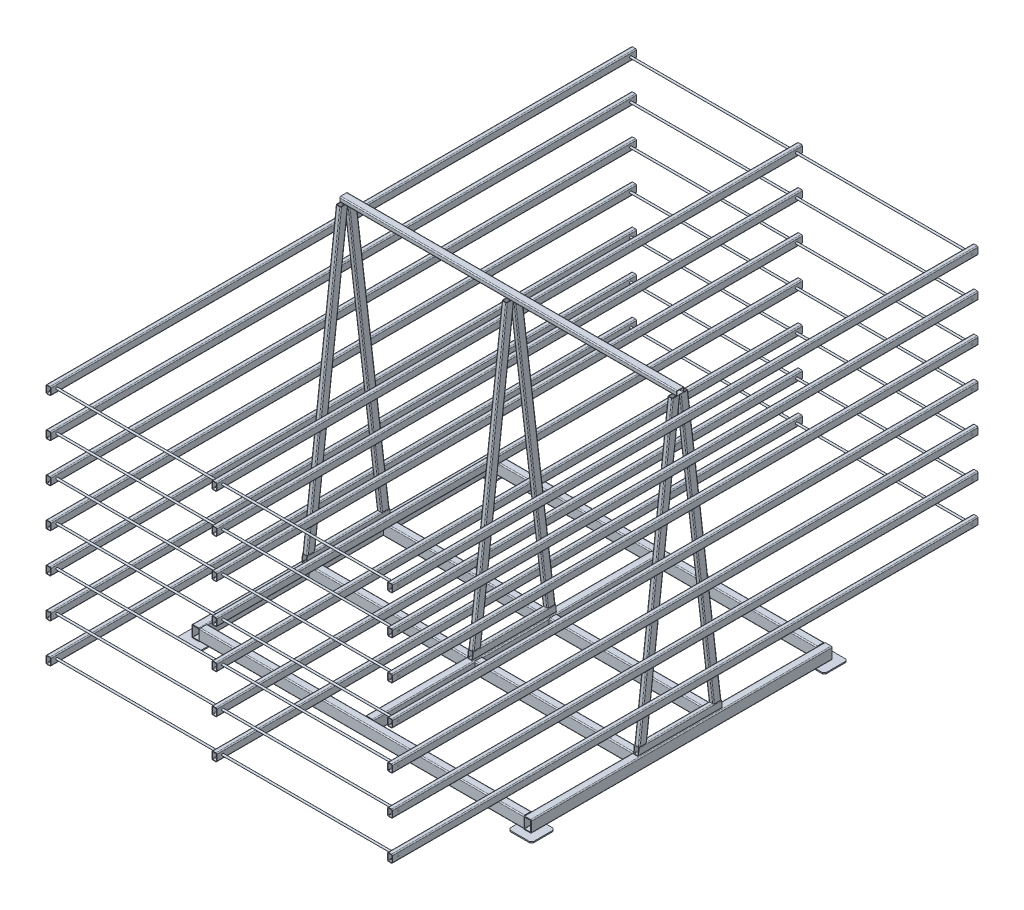
from build123d import *

# Parameters (mm, degrees)
F_50_START                    = -830
F_50_X_30_X_2_6_1_DEPTH       = 1660
F_50_START_2                  = -770
F_50_X_30_X_2_6_1_2_DEPTH     = 1540
F_50_X_30_X_2_6_1_3_DEPTH     = 1540
F_50_X_30_X_2_6_1_4_DEPTH     = 1660
F_50_START_3                  = -730
F_50_X_30_X_2_6_1_5_DEPTH     = 1460
F_50_START_4                  = 20
F_50_X_30_X_2_6_1_6_DEPTH     = 810
F_50_X_30_X_2_6_1_7_DEPTH     = 810
F_50_X_30_X_2_6_1_8_DEPTH     = 810
F_50_X_30_X_2_6_1_9_DEPTH     = 810
SKETCH_9_W                    = 120
SKETCH_9_H                    = 120
EXTRUDE_2_DEPTH               = 6
CHAMFER_1_SIZE                = 10
F_50_START_5                  = 45.123407244
F_50_X_30_X_2_6_4_DEPTH       = 1474.569195559
F_50_START_6                  = 64
F_50_X_30_X_2_6_4_2_OUTLINE_W = 28
F_50_X_30_X_2_6_4_2_OUTLINE_H = 43
F_50_X_30_X_2_6_4_2_DEPTH     = 6
F_50_START_7                  = -175
F_50_X_30_X_2_6_4_3_DEPTH     = 390.271302161
F_50_START_8                  = 217.297470327
F_50_X_30_X_2_6_4_4_OUTLINE_W = 28
F_50_X_30_X_2_6_4_4_OUTLINE_H = 44
F_50_X_30_X_2_6_4_4_DEPTH     = 5.702529673
F_50_X_30_X_2_6_9_DEPTH       = 1725
F_50_X_30_X_2_6_10_DEPTH      = 3000
PATTERN_LINEAR_2_COUNT        = 7
PATTERN_LINEAR_2_PITCH        = 200
PATTERN_LINEAR_3_COUNT        = 2
PATTERN_LINEAR_3_PITCH        = 850
SKETCH_8_R                    = 5
CUT_EXTRUDE_1_DEPTH           = 2345.381581569
PATTERN_LINEAR_4_COUNT        = 7
PATTERN_LINEAR_4_PITCH        = 200
EXTRUDE_1_DEPTH               = 887.5
EXTRUDE_1_DEPTH_BACK          = 887.5
SKETCH_8_2_R                  = 5
PATTERN_LINEAR_5_COUNT        = 7
PATTERN_LINEAR_5_PITCH        = 200
MIRROR_4_COPY_1_SKETCH_R      = 5
MIRROR_4_COPY_1_DEPTH         = 2345.381581569
MIRROR_4_COPY_2_SKETCH_R      = 5
MIRROR_4_COPY_2_DEPTH         = 2345.381581569
MIRROR_4_COPY_3_SKETCH_R      = 5
MIRROR_4_COPY_3_DEPTH         = 2345.381581569
MIRROR_4_COPY_4_SKETCH_R      = 5
MIRROR_4_COPY_4_DEPTH         = 2345.381581569
MIRROR_4_COPY_5_SKETCH_R      = 5
MIRROR_4_COPY_5_DEPTH         = 2345.381581569
MIRROR_4_COPY_6_SKETCH_R      = 5
MIRROR_4_COPY_6_DEPTH         = 2345.381581569
MIRROR_5_ANGLE                = 180
MIRROR_5_2_ANGLE              = 180
MIRROR_5_3_ANGLE              = 180
MIRROR_5_4_ANGLE              = 180
MIRROR_5_5_ANGLE              = 180
MIRROR_5_6_ANGLE              = 180
MIRROR_5_7_ANGLE              = 180


with BuildPart() as part:
    # Прямоугольная труба 50 X 30 X 2.6(1): read off the stored shape, not the designer's step
    # Прямоугольная труба 50 X 30 X 2.6(1) outline → Прямоугольная труба 50 X 30 X 2.6(1) (new body)
    with BuildSketch(Plane.YZ.offset(F_50_START)):
        with BuildLine():
            ThreePointArc((24.8, -770), (28.476955262, -768.476955262), (30, -764.8))
            Line((30, -764.8), (30, -735.2))
            ThreePointArc((30, -735.2), (28.476955262, -731.523044738), (24.8, -730))
            Line((24.8, -730), (-24.8, -730))
            ThreePointArc((-24.8, -730), (-28.476955262, -731.523044738), (-30, -735.2))
            Line((-30, -735.2), (-30, -764.8))
            ThreePointArc((-30, -764.8), (-28.476955262, -768.476955262), (-24.8, -770))
            Line((-24.8, -770), (24.8, -770))
        make_face()
        with BuildLine():
            Line((-24.8, -734), (24.8, -734))
            ThreePointArc((24.8, -734), (25.648528137, -734.351471863), (26, -735.2))
            Line((26, -735.2), (26, -764.8))
            ThreePointArc((26, -764.8), (25.648528137, -765.648528137), (24.8, -766))
            Line((24.8, -766), (-24.8, -766))
            ThreePointArc((-24.8, -766), (-25.648528137, -765.648528137), (-26, -764.8))
            Line((-26, -764.8), (-26, -735.2))
            ThreePointArc((-26, -735.2), (-25.648528137, -734.351471863), (-24.8, -734))
        make_face(mode=Mode.SUBTRACT)
    extrude(amount=F_50_X_30_X_2_6_1_DEPTH)


with BuildPart() as body_2:
    # 50 X 30 X 2.6_1 2 outline → 50 X 30 X 2.6_1 2 (new body)
    with BuildSketch(Plane.XY.offset(F_50_START_2)):
        with BuildLine():
            Line((-835.2, 30), (-864.8, 30))
            ThreePointArc((-864.8, 30), (-868.476955262, 28.476955262), (-870, 24.8))
            Line((-870, 24.8), (-870, -24.8))
            ThreePointArc((-870, -24.8), (-868.476955262, -28.476955262), (-864.8, -30))
            Line((-864.8, -30), (-835.2, -30))
            ThreePointArc((-835.2, -30), (-831.523044738, -28.476955262), (-830, -24.8))
            Line((-830, -24.8), (-830, 24.8))
            ThreePointArc((-830, 24.8), (-831.523044738, 28.476955262), (-835.2, 30))
        make_face()
        with BuildLine():
            ThreePointArc((-835.2, 26), (-834.351471863, 25.648528137), (-834, 24.8))
            Line((-834, 24.8), (-834, -24.8))
            ThreePointArc((-834, -24.8), (-834.351471863, -25.648528137), (-835.2, -26))
            Line((-835.2, -26), (-864.8, -26))
            ThreePointArc((-864.8, -26), (-865.648528137, -25.648528137), (-866, -24.8))
            Line((-866, -24.8), (-866, 24.8))
            ThreePointArc((-866, 24.8), (-865.648528137, 25.648528137), (-864.8, 26))
            Line((-864.8, 26), (-835.2, 26))
        make_face(mode=Mode.SUBTRACT)
    extrude(amount=F_50_X_30_X_2_6_1_2_DEPTH)


with BuildPart() as body_3:
    # 50 X 30 X 2.6_1 3 outline → 50 X 30 X 2.6_1 3 (new body)
    with BuildSketch(Plane.XY.offset(F_50_START_2)):
        with BuildLine():
            ThreePointArc((870, 24.8), (868.476955262, 28.476955262), (864.8, 30))
            Line((864.8, 30), (835.2, 30))
            ThreePointArc((835.2, 30), (831.523044738, 28.476955262), (830, 24.8))
            Line((830, 24.8), (830, -24.8))
            ThreePointArc((830, -24.8), (831.523044738, -28.476955262), (835.2, -30))
            Line((835.2, -30), (864.8, -30))
            ThreePointArc((864.8, -30), (868.476955262, -28.476955262), (870, -24.8))
            Line((870, -24.8), (870, 24.8))
        make_face()
        with BuildLine():
            Line((834, -24.8), (834, 24.8))
            ThreePointArc((834, 24.8), (834.351471863, 25.648528137), (835.2, 26))
            Line((835.2, 26), (864.8, 26))
            ThreePointArc((864.8, 26), (865.648528137, 25.648528137), (866, 24.8))
            Line((866, 24.8), (866, -24.8))
            ThreePointArc((866, -24.8), (865.648528137, -25.648528137), (864.8, -26))
            Line((864.8, -26), (835.2, -26))
            ThreePointArc((835.2, -26), (834.351471863, -25.648528137), (834, -24.8))
        make_face(mode=Mode.SUBTRACT)
    extrude(amount=F_50_X_30_X_2_6_1_3_DEPTH)


with BuildPart() as body_4:
    # 50 X 30 X 2.6_1 4 outline → 50 X 30 X 2.6_1 4 (new body)
    with BuildSketch(Plane.YZ.offset(F_50_START)):
        with BuildLine():
            Line((30, 735.2), (30, 764.8))
            ThreePointArc((30, 764.8), (28.476955262, 768.476955262), (24.8, 770))
            Line((24.8, 770), (-24.8, 770))
            ThreePointArc((-24.8, 770), (-28.476955262, 768.476955262), (-30, 764.8))
            Line((-30, 764.8), (-30, 735.2))
            ThreePointArc((-30, 735.2), (-28.476955262, 731.523044738), (-24.8, 730))
            Line((-24.8, 730), (24.8, 730))
            ThreePointArc((24.8, 730), (28.476955262, 731.523044738), (30, 735.2))
        make_face()
        with BuildLine():
            ThreePointArc((26, 735.2), (25.648528137, 734.351471863), (24.8, 734))
            Line((24.8, 734), (-24.8, 734))
            ThreePointArc((-24.8, 734), (-25.648528137, 734.351471863), (-26, 735.2))
            Line((-26, 735.2), (-26, 764.8))
            ThreePointArc((-26, 764.8), (-25.648528137, 765.648528137), (-24.8, 766))
            Line((-24.8, 766), (24.8, 766))
            ThreePointArc((24.8, 766), (25.648528137, 765.648528137), (26, 764.8))
            Line((26, 764.8), (26, 735.2))
        make_face(mode=Mode.SUBTRACT)
    extrude(amount=F_50_X_30_X_2_6_1_4_DEPTH)


with BuildPart() as body_5:
    # 50 X 30 X 2.6_1 5 outline → 50 X 30 X 2.6_1 5 (new body)
    with BuildSketch(Plane.XY.offset(F_50_START_3)):
        with BuildLine():
            ThreePointArc((20, 24.8), (18.476955262, 28.476955262), (14.8, 30))
            Line((14.8, 30), (-14.8, 30))
            ThreePointArc((-14.8, 30), (-18.476955262, 28.476955262), (-20, 24.8))
            Line((-20, 24.8), (-20, -24.8))
            ThreePointArc((-20, -24.8), (-18.476955262, -28.476955262), (-14.8, -30))
            Line((-14.8, -30), (14.8, -30))
            ThreePointArc((14.8, -30), (18.476955262, -28.476955262), (20, -24.8))
            Line((20, -24.8), (20, 24.8))
        make_face()
        with BuildLine():
            Line((-16, -24.8), (-16, 24.8))
            ThreePointArc((-16, 24.8), (-15.648528137, 25.648528137), (-14.8, 26))
            Line((-14.8, 26), (14.8, 26))
            ThreePointArc((14.8, 26), (15.648528137, 25.648528137), (16, 24.8))
            Line((16, 24.8), (16, -24.8))
            ThreePointArc((16, -24.8), (15.648528137, -25.648528137), (14.8, -26))
            Line((14.8, -26), (-14.8, -26))
            ThreePointArc((-14.8, -26), (-15.648528137, -25.648528137), (-16, -24.8))
        make_face(mode=Mode.SUBTRACT)
    extrude(amount=F_50_X_30_X_2_6_1_5_DEPTH)


with BuildPart() as body_6:
    # 50 X 30 X 2.6_1 6 outline → 50 X 30 X 2.6_1 6 (new body)
    with BuildSketch(Plane.YZ.offset(F_50_START_4)):
        with BuildLine():
            Line((30, -205.3), (30, -175.7))
            ThreePointArc((30, -175.7), (28.476955262, -172.023044738), (24.8, -170.5))
            Line((24.8, -170.5), (-24.8, -170.5))
            ThreePointArc((-24.8, -170.5), (-28.476955262, -172.023044738), (-30, -175.7))
            Line((-30, -175.7), (-30, -205.3))
            ThreePointArc((-30, -205.3), (-28.476955262, -208.976955262), (-24.8, -210.5))
            Line((-24.8, -210.5), (24.8, -210.5))
            ThreePointArc((24.8, -210.5), (28.476955262, -208.976955262), (30, -205.3))
        make_face()
        with BuildLine():
            ThreePointArc((26, -205.3), (25.648528137, -206.148528137), (24.8, -206.5))
            Line((24.8, -206.5), (-24.8, -206.5))
            ThreePointArc((-24.8, -206.5), (-25.648528137, -206.148528137), (-26, -205.3))
            Line((-26, -205.3), (-26, -175.7))
            ThreePointArc((-26, -175.7), (-25.648528137, -174.851471863), (-24.8, -174.5))
            Line((-24.8, -174.5), (24.8, -174.5))
            ThreePointArc((24.8, -174.5), (25.648528137, -174.851471863), (26, -175.7))
            Line((26, -175.7), (26, -205.3))
        make_face(mode=Mode.SUBTRACT)
    extrude(amount=F_50_X_30_X_2_6_1_6_DEPTH)


with BuildPart() as body_7:
    # 50 X 30 X 2.6_1 7 outline → 50 X 30 X 2.6_1 7 (new body)
    with BuildSketch(Plane.YZ.offset(F_50_START)):
        with BuildLine():
            Line((24.8, -170.5), (-24.8, -170.5))
            ThreePointArc((-24.8, -170.5), (-28.476955262, -172.023044738), (-30, -175.7))
            Line((-30, -175.7), (-30, -205.3))
            ThreePointArc((-30, -205.3), (-28.476955262, -208.976955262), (-24.8, -210.5))
            Line((-24.8, -210.5), (24.8, -210.5))
            ThreePointArc((24.8, -210.5), (28.476955262, -208.976955262), (30, -205.3))
            Line((30, -205.3), (30, -175.7))
            ThreePointArc((30, -175.7), (28.476955262, -172.023044738), (24.8, -170.5))
        make_face()
        with BuildLine():
            ThreePointArc((26, -205.3), (25.648528137, -206.148528137), (24.8, -206.5))
            Line((24.8, -206.5), (-24.8, -206.5))
            ThreePointArc((-24.8, -206.5), (-25.648528137, -206.148528137), (-26, -205.3))
            Line((-26, -205.3), (-26, -175.7))
            ThreePointArc((-26, -175.7), (-25.648528137, -174.851471863), (-24.8, -174.5))
            Line((-24.8, -174.5), (24.8, -174.5))
            ThreePointArc((24.8, -174.5), (25.648528137, -174.851471863), (26, -175.7))
            Line((26, -175.7), (26, -205.3))
        make_face(mode=Mode.SUBTRACT)
    extrude(amount=F_50_X_30_X_2_6_1_7_DEPTH)


with BuildPart() as body_8:
    # 50 X 30 X 2.6_1 8 outline → 50 X 30 X 2.6_1 8 (new body)
    with BuildSketch(Plane.YZ.offset(F_50_START_4)):
        with BuildLine():
            Line((30, 175.7), (30, 205.3))
            ThreePointArc((30, 205.3), (28.476955262, 208.976955262), (24.8, 210.5))
            Line((24.8, 210.5), (-24.8, 210.5))
            ThreePointArc((-24.8, 210.5), (-28.476955262, 208.976955262), (-30, 205.3))
            Line((-30, 205.3), (-30, 175.7))
            ThreePointArc((-30, 175.7), (-28.476955262, 172.023044738), (-24.8, 170.5))
            Line((-24.8, 170.5), (24.8, 170.5))
            ThreePointArc((24.8, 170.5), (28.476955262, 172.023044738), (30, 175.7))
        make_face()
        with BuildLine():
            ThreePointArc((26, 175.7), (25.648528137, 174.851471863), (24.8, 174.5))
            Line((24.8, 174.5), (-24.8, 174.5))
            ThreePointArc((-24.8, 174.5), (-25.648528137, 174.851471863), (-26, 175.7))
            Line((-26, 175.7), (-26, 205.3))
            ThreePointArc((-26, 205.3), (-25.648528137, 206.148528137), (-24.8, 206.5))
            Line((-24.8, 206.5), (24.8, 206.5))
            ThreePointArc((24.8, 206.5), (25.648528137, 206.148528137), (26, 205.3))
            Line((26, 205.3), (26, 175.7))
        make_face(mode=Mode.SUBTRACT)
    extrude(amount=F_50_X_30_X_2_6_1_8_DEPTH)


with BuildPart() as body_9:
    # 50 X 30 X 2.6_1 9 outline → 50 X 30 X 2.6_1 9 (new body)
    with BuildSketch(Plane.YZ.offset(F_50_START)):
        with BuildLine():
            Line((24.8, 210.5), (-24.8, 210.5))
            ThreePointArc((-24.8, 210.5), (-28.476955262, 208.976955262), (-30, 205.3))
            Line((-30, 205.3), (-30, 175.7))
            ThreePointArc((-30, 175.7), (-28.476955262, 172.023044738), (-24.8, 170.5))
            Line((-24.8, 170.5), (24.8, 170.5))
            ThreePointArc((24.8, 170.5), (28.476955262, 172.023044738), (30, 175.7))
            Line((30, 175.7), (30, 205.3))
            ThreePointArc((30, 205.3), (28.476955262, 208.976955262), (24.8, 210.5))
        make_face()
        with BuildLine():
            ThreePointArc((26, 175.7), (25.648528137, 174.851471863), (24.8, 174.5))
            Line((24.8, 174.5), (-24.8, 174.5))
            ThreePointArc((-24.8, 174.5), (-25.648528137, 174.851471863), (-26, 175.7))
            Line((-26, 175.7), (-26, 205.3))
            ThreePointArc((-26, 205.3), (-25.648528137, 206.148528137), (-24.8, 206.5))
            Line((-24.8, 206.5), (24.8, 206.5))
            ThreePointArc((24.8, 206.5), (25.648528137, 206.148528137), (26, 205.3))
            Line((26, 205.3), (26, 175.7))
        make_face(mode=Mode.SUBTRACT)
    extrude(amount=F_50_X_30_X_2_6_1_9_DEPTH)


with BuildPart() as body_10:
    # Эскиз9 → Бобышка-Вытянуть2 (new body)
    with BuildSketch(Plane.XZ.offset(30)):
        with Locations((850, 750)):
            Rectangle(SKETCH_9_W, SKETCH_9_H)
    extrude(amount=EXTRUDE_2_DEPTH)

    # Фаска1
    chamfer_1_edges = [body_10.edges().sort_by_distance(p)[0] for p in [
        (910, -33, 690),
        (790, -33, 690),
        (790, -33, 810),
        (910, -33, 810),
    ]]
    chamfer(chamfer_1_edges, length=CHAMFER_1_SIZE)


with BuildPart() as body_11:
    # Зеркальное отражение6: mirrored copy
    add(body_10.part.mirror(Plane(origin=(0, 0, 0), x_dir=(0, 0, 1), z_dir=(1, 0, 0))))


with BuildPart() as body_12:
    # Зеркальное отражение7: mirrored copy
    add(body_10.part.mirror(Plane.XY))


with BuildPart() as body_13:
    # Mirror 7 2: mirrored copy
    add(body_11.part.mirror(Plane.XY))


with BuildPart() as body_14:
    # Прямоугольная труба 50 X 30 X 2.6(4): read off the stored shape, not the designer's step
    # Прямоугольная труба 50 X 30 X 2.6(4) outline → Прямоугольная труба 50 X 30 X 2.6(4) (new body)
    with BuildSketch(Plane(origin=(0, 0, 0), x_dir=(1, 0, 0), z_dir=(0, 0.9932631390872431, -0.11588069956017802)).offset(F_50_START_5)):
        with BuildLine():
            Line((-837.5, -212.097470327), (-837.5, -182.497470327))
            ThreePointArc((-837.5, -182.497470327), (-839.023044738, -178.820515065), (-842.7, -177.297470327))
            Line((-842.7, -177.297470327), (-857.3, -177.297470327))
            ThreePointArc((-857.3, -177.297470327), (-860.976955262, -178.820515065), (-862.5, -182.497470327))
            Line((-862.5, -182.497470327), (-862.5, -212.097470327))
            ThreePointArc((-862.5, -212.097470327), (-860.976955262, -215.774425589), (-857.3, -217.297470327))
            Line((-857.3, -217.297470327), (-842.7, -217.297470327))
            ThreePointArc((-842.7, -217.297470327), (-839.023044738, -215.774425589), (-837.5, -212.097470327))
        make_face()
        with BuildLine():
            ThreePointArc((-857.3, -214.697470327), (-859.138477631, -213.935947958), (-859.9, -212.097470327))
            Line((-859.9, -212.097470327), (-859.9, -182.497470327))
            ThreePointArc((-859.9, -182.497470327), (-859.138477631, -180.658992696), (-857.3, -179.897470327))
            Line((-857.3, -179.897470327), (-842.7, -179.897470327))
            ThreePointArc((-842.7, -179.897470327), (-840.861522369, -180.658992696), (-840.1, -182.497470327))
            Line((-840.1, -182.497470327), (-840.1, -212.097470327))
            ThreePointArc((-840.1, -212.097470327), (-840.861522369, -213.935947958), (-842.7, -214.697470327))
            Line((-842.7, -214.697470327), (-857.3, -214.697470327))
        make_face(mode=Mode.SUBTRACT)
    extrude(amount=F_50_X_30_X_2_6_4_DEPTH)

    # 50 X 30 X 2.6_4 2 outline → 50 X 30 X 2.6_4 2 (cut)
    with BuildSketch(Plane(origin=(0, 0, 0), x_dir=(1, 0, 0), z_dir=(0, 1, 0)).offset(F_50_START_6)):
        with Locations((-850, -190.5)):
            Rectangle(F_50_X_30_X_2_6_4_2_OUTLINE_W, F_50_X_30_X_2_6_4_2_OUTLINE_H)
    extrude(amount=F_50_X_30_X_2_6_4_2_DEPTH, mode=Mode.SUBTRACT)


with BuildPart() as body_15:
    # 50 X 30 X 2.6_4 3 outline → 50 X 30 X 2.6_4 3 (new body)
    with BuildSketch(Plane.XY.offset(F_50_START_7)):
        with BuildLine():
            ThreePointArc((-837.5, 64.8), (-839.023044738, 68.476955262), (-842.7, 70))
            Line((-842.7, 70), (-857.3, 70))
            ThreePointArc((-857.3, 70), (-860.976955262, 68.476955262), (-862.5, 64.8))
            Line((-862.5, 64.8), (-862.5, 35.2))
            ThreePointArc((-862.5, 35.2), (-860.976955262, 31.523044738), (-857.3, 30))
            Line((-857.3, 30), (-842.7, 30))
            ThreePointArc((-842.7, 30), (-839.023044738, 31.523044738), (-837.5, 35.2))
            Line((-837.5, 35.2), (-837.5, 64.8))
        make_face()
        with BuildLine():
            Line((-859.9, 35.2), (-859.9, 64.8))
            ThreePointArc((-859.9, 64.8), (-859.138477631, 66.638477631), (-857.3, 67.4))
            Line((-857.3, 67.4), (-842.7, 67.4))
            ThreePointArc((-842.7, 67.4), (-840.861522369, 66.638477631), (-840.1, 64.8))
            Line((-840.1, 64.8), (-840.1, 35.2))
            ThreePointArc((-840.1, 35.2), (-840.861522369, 33.361522369), (-842.7, 32.6))
            Line((-842.7, 32.6), (-857.3, 32.6))
            ThreePointArc((-857.3, 32.6), (-859.138477631, 33.361522369), (-859.9, 35.2))
        make_face(mode=Mode.SUBTRACT)
    extrude(amount=F_50_X_30_X_2_6_4_3_DEPTH)

    # 50 X 30 X 2.6_4 4 outline → 50 X 30 X 2.6_4 4 (cut)
    with BuildSketch(Plane(origin=(0, 0, 0), x_dir=(1, 0, 0), z_dir=(0, 0.11588069956017802, 0.9932631390872431)).offset(F_50_START_8)):
        with Locations((-850, 25)):
            Rectangle(F_50_X_30_X_2_6_4_4_OUTLINE_W, F_50_X_30_X_2_6_4_4_OUTLINE_H)
    extrude(amount=F_50_X_30_X_2_6_4_4_DEPTH, mode=Mode.SUBTRACT)


with BuildPart() as body_16:
    # Weld Trim 1: read off the stored shape, not the designer's step
    # Weld Trim 1: the piece on the far side of the plane
    add(body_15.part)
    split(bisect_by=Plane.XY, keep=Keep.BOTTOM)


with BuildPart() as body_15_1:
    add(body_15.part)

    # Weld Trim 1
    split(bisect_by=Plane.XY, keep=Keep.TOP)


with BuildPart() as body_16_2:
    # Зеркальное отражение2: mirrored copy
    add(body_14.part.mirror(Plane.XY))

    # Weld Trim 2 2
    split(bisect_by=Plane.XZ.offset(-1530), keep=Keep.TOP)


with BuildPart() as body_17:
    # Mirror 2 2: mirrored copy
    add(body_15_1.part.mirror(Plane.XY))

    # Combine 1: union body 15
    add(body_15_1.part)


with BuildPart() as body_14_1:
    add(body_14.part)

    # Weld Trim 2 2
    split(bisect_by=Plane.XZ.offset(-1530), keep=Keep.TOP)


with BuildPart() as body_17_2:
    # Линейный массив1: read off the stored shape, not the designer's step
    # Линейный массив1: copy of body 17
    add(body_17.part.moved(Location((1700, 0, 0))))


with BuildPart() as body_18:
    # Pattern Linear 1 2: copy of body 17
    add(body_17.part.moved(Location((850, 0, 0))))


with BuildPart() as body_19:
    # Pattern Linear 1 3: copy of body 16 2
    add(body_16_2.part.moved(Location((1700, 0, 0))))


with BuildPart() as body_20:
    # Pattern Linear 1 4: copy of body 16 2
    add(body_16_2.part.moved(Location((850, 0, 0))))


with BuildPart() as body_21:
    # Pattern Linear 1 5: copy of body 14
    add(body_14_1.part.moved(Location((1700, 0, 0))))


with BuildPart() as body_22:
    # Pattern Linear 1 6: copy of body 14
    add(body_14_1.part.moved(Location((850, 0, 0))))


with BuildPart() as body_23:
    # Sketch12 → Прямоугольная труба 50 X 30 X 2.6(9) (new body)
    with BuildSketch(Plane(origin=(-862.5, 1542.5, 0), x_dir=(0, 1, 0), z_dir=(1, 0, 0))):
        with BuildLine():
            Line((-7.3, -20), (7.3, -20))
            ThreePointArc((7.3, -20), (10.976955262, -18.476955262), (12.5, -14.8))
            Line((12.5, -14.8), (12.5, 14.8))
            ThreePointArc((12.5, 14.8), (10.976955262, 18.476955262), (7.3, 20))
            Line((7.3, 20), (-7.3, 20))
            ThreePointArc((-7.3, 20), (-10.976955262, 18.476955262), (-12.5, 14.8))
            Line((-12.5, 14.8), (-12.5, -14.8))
            ThreePointArc((-12.5, -14.8), (-10.976955262, -18.476955262), (-7.3, -20))
        make_face()
        with BuildLine():
            Line((-7.3, -17.4), (7.3, -17.4))
            ThreePointArc((7.3, -17.4), (9.138477631, -16.638477631), (9.9, -14.8))
            Line((9.9, -14.8), (9.9, 14.8))
            ThreePointArc((9.9, 14.8), (9.138477631, 16.638477631), (7.3, 17.4))
            Line((7.3, 17.4), (-7.3, 17.4))
            ThreePointArc((-7.3, 17.4), (-9.138477631, 16.638477631), (-9.9, 14.8))
            Line((-9.9, 14.8), (-9.9, -14.8))
            ThreePointArc((-9.9, -14.8), (-9.138477631, -16.638477631), (-7.3, -17.4))
        make_face(mode=Mode.SUBTRACT)
    extrude(amount=F_50_X_30_X_2_6_9_DEPTH)


with BuildPart() as body_24:
    # Sketch13 → Прямоугольная труба 50 X 30 X 2.6(10) (new body)
    with BuildSketch(Plane(origin=(-875, 230, -1500), x_dir=(1, 0, 0), z_dir=(0, 0, 1))):
        with BuildLine():
            Line((-7.3, -20), (7.3, -20))
            ThreePointArc((7.3, -20), (10.976955262, -18.476955262), (12.5, -14.8))
            Line((12.5, -14.8), (12.5, 14.8))
            ThreePointArc((12.5, 14.8), (10.976955262, 18.476955262), (7.3, 20))
            Line((7.3, 20), (-7.3, 20))
            ThreePointArc((-7.3, 20), (-10.976955262, 18.476955262), (-12.5, 14.8))
            Line((-12.5, 14.8), (-12.5, -14.8))
            ThreePointArc((-12.5, -14.8), (-10.976955262, -18.476955262), (-7.3, -20))
        make_face()
        with BuildLine():
            Line((-7.3, -17.4), (7.3, -17.4))
            ThreePointArc((7.3, -17.4), (9.138477631, -16.638477631), (9.9, -14.8))
            Line((9.9, -14.8), (9.9, 14.8))
            ThreePointArc((9.9, 14.8), (9.138477631, 16.638477631), (7.3, 17.4))
            Line((7.3, 17.4), (-7.3, 17.4))
            ThreePointArc((-7.3, 17.4), (-9.138477631, 16.638477631), (-9.9, 14.8))
            Line((-9.9, 14.8), (-9.9, -14.8))
            ThreePointArc((-9.9, -14.8), (-9.138477631, -16.638477631), (-7.3, -17.4))
        make_face(mode=Mode.SUBTRACT)
    extrude(amount=F_50_X_30_X_2_6_10_DEPTH)


with BuildPart() as pattern_linear_2_1:
    # Линейный массив2: pattern copy
    add(body_24.part.moved(Location(Vector(0, 1, 0) * (1 * PATTERN_LINEAR_2_PITCH))))


with BuildPart() as pattern_linear_2_2:
    # Линейный массив2: pattern copy
    add(body_24.part.moved(Location(Vector(0, 1, 0) * (2 * PATTERN_LINEAR_2_PITCH))))


with BuildPart() as pattern_linear_2_3:
    # Линейный массив2: pattern copy
    add(body_24.part.moved(Location(Vector(0, 1, 0) * (3 * PATTERN_LINEAR_2_PITCH))))


with BuildPart() as pattern_linear_2_4:
    # Линейный массив2: pattern copy
    add(body_24.part.moved(Location(Vector(0, 1, 0) * (4 * PATTERN_LINEAR_2_PITCH))))


with BuildPart() as pattern_linear_2_5:
    # Линейный массив2: pattern copy
    add(body_24.part.moved(Location(Vector(0, 1, 0) * (5 * PATTERN_LINEAR_2_PITCH))))


with BuildPart() as pattern_linear_2_6:
    # Линейный массив2: pattern copy
    add(body_24.part.moved(Location(Vector(0, 1, 0) * (6 * PATTERN_LINEAR_2_PITCH))))


with BuildPart() as body_31:
    # Зеркальное отражение3: mirrored copy
    add(body_24.part.mirror(Plane(origin=(0, 0, 0), x_dir=(0, 0, 1), z_dir=(1, 0, 0))))


with BuildPart() as body_32:
    # Mirror 3 2: mirrored copy
    add(pattern_linear_2_1.part.mirror(Plane(origin=(0, 0, 0), x_dir=(0, 0, 1), z_dir=(1, 0, 0))))


with BuildPart() as body_33:
    # Mirror 3 3: mirrored copy
    add(pattern_linear_2_2.part.mirror(Plane(origin=(0, 0, 0), x_dir=(0, 0, 1), z_dir=(1, 0, 0))))


with BuildPart() as body_34:
    # Mirror 3 4: mirrored copy
    add(pattern_linear_2_3.part.mirror(Plane(origin=(0, 0, 0), x_dir=(0, 0, 1), z_dir=(1, 0, 0))))


with BuildPart() as body_35:
    # Mirror 3 5: mirrored copy
    add(pattern_linear_2_4.part.mirror(Plane(origin=(0, 0, 0), x_dir=(0, 0, 1), z_dir=(1, 0, 0))))


with BuildPart() as body_36:
    # Mirror 3 6: mirrored copy
    add(pattern_linear_2_5.part.mirror(Plane(origin=(0, 0, 0), x_dir=(0, 0, 1), z_dir=(1, 0, 0))))


with BuildPart() as body_37:
    # Mirror 3 7: mirrored copy
    add(pattern_linear_2_6.part.mirror(Plane(origin=(0, 0, 0), x_dir=(0, 0, 1), z_dir=(1, 0, 0))))


with BuildPart() as pattern_linear_3_1:
    # Линейный массив3: pattern copy
    add(body_24.part.moved(Location(Vector(1, 0, 0) * (1 * PATTERN_LINEAR_3_PITCH))))


with BuildPart() as pattern_linear_3_2:
    # Линейный массив3: pattern copy
    add(pattern_linear_2_1.part.moved(Location(Vector(1, 0, 0) * (1 * PATTERN_LINEAR_3_PITCH))))


with BuildPart() as pattern_linear_3_3:
    # Линейный массив3: pattern copy
    add(pattern_linear_2_2.part.moved(Location(Vector(1, 0, 0) * (1 * PATTERN_LINEAR_3_PITCH))))


with BuildPart() as pattern_linear_3_4:
    # Линейный массив3: pattern copy
    add(pattern_linear_2_3.part.moved(Location(Vector(1, 0, 0) * (1 * PATTERN_LINEAR_3_PITCH))))


with BuildPart() as pattern_linear_3_5:
    # Линейный массив3: pattern copy
    add(pattern_linear_2_4.part.moved(Location(Vector(1, 0, 0) * (1 * PATTERN_LINEAR_3_PITCH))))


with BuildPart() as pattern_linear_3_6:
    # Линейный массив3: pattern copy
    add(pattern_linear_2_5.part.moved(Location(Vector(1, 0, 0) * (1 * PATTERN_LINEAR_3_PITCH))))


with BuildPart() as pattern_linear_3_7:
    # Линейный массив3: pattern copy
    add(pattern_linear_2_6.part.moved(Location(Vector(1, 0, 0) * (1 * PATTERN_LINEAR_3_PITCH))))


with BuildPart() as cut_extrude_1_tool:
    # Эскиз8 → Вырез-Вытянуть1 (new, symmetric)
    with BuildSketch(Plane(origin=(0, 0, 0), x_dir=(0, 0, -1), z_dir=(1, 0, 0))):
        with Locations((-1470, 1430)):
            Circle(SKETCH_8_R)
    cut_extrude_1 = extrude(amount=CUT_EXTRUDE_1_DEPTH, both=True)


with BuildPart() as pattern_linear_2_6_1:
    add(pattern_linear_2_6.part)

    # Вырез-Вытянуть1: cut by cut_extrude_1_tool
    add(cut_extrude_1_tool.part, mode=Mode.SUBTRACT)


with BuildPart() as body_37_1:
    add(body_37.part)

    # Вырез-Вытянуть1: cut by cut_extrude_1_tool
    add(cut_extrude_1_tool.part, mode=Mode.SUBTRACT)


with BuildPart() as pattern_linear_3_7_1:
    add(pattern_linear_3_7.part)

    # Вырез-Вытянуть1: cut by cut_extrude_1_tool
    add(cut_extrude_1_tool.part, mode=Mode.SUBTRACT)


with BuildPart() as pattern_linear_4_tool:
    # Линейный массив4: Вырез-Вытянуть1 ×7
    with Locations(*[(0, -i * PATTERN_LINEAR_4_PITCH, 0) for i in range(1, PATTERN_LINEAR_4_COUNT)]):
        add(cut_extrude_1)


with BuildPart() as body_24_1:
    add(body_24.part)

    # Линейный массив4: cut by pattern_linear_4_tool
    add(pattern_linear_4_tool.part, mode=Mode.SUBTRACT)


with BuildPart() as pattern_linear_2_1_1:
    add(pattern_linear_2_1.part)

    # Линейный массив4: cut by pattern_linear_4_tool
    add(pattern_linear_4_tool.part, mode=Mode.SUBTRACT)


with BuildPart() as pattern_linear_2_2_1:
    add(pattern_linear_2_2.part)

    # Линейный массив4: cut by pattern_linear_4_tool
    add(pattern_linear_4_tool.part, mode=Mode.SUBTRACT)


with BuildPart() as pattern_linear_2_3_1:
    add(pattern_linear_2_3.part)

    # Линейный массив4: cut by pattern_linear_4_tool
    add(pattern_linear_4_tool.part, mode=Mode.SUBTRACT)


with BuildPart() as pattern_linear_2_4_1:
    add(pattern_linear_2_4.part)

    # Линейный массив4: cut by pattern_linear_4_tool
    add(pattern_linear_4_tool.part, mode=Mode.SUBTRACT)


with BuildPart() as pattern_linear_2_5_1:
    add(pattern_linear_2_5.part)

    # Линейный массив4: cut by pattern_linear_4_tool
    add(pattern_linear_4_tool.part, mode=Mode.SUBTRACT)


with BuildPart() as body_31_1:
    add(body_31.part)

    # Линейный массив4: cut by pattern_linear_4_tool
    add(pattern_linear_4_tool.part, mode=Mode.SUBTRACT)


with BuildPart() as body_32_1:
    add(body_32.part)

    # Линейный массив4: cut by pattern_linear_4_tool
    add(pattern_linear_4_tool.part, mode=Mode.SUBTRACT)


with BuildPart() as body_33_1:
    add(body_33.part)

    # Линейный массив4: cut by pattern_linear_4_tool
    add(pattern_linear_4_tool.part, mode=Mode.SUBTRACT)


with BuildPart() as body_34_1:
    add(body_34.part)

    # Линейный массив4: cut by pattern_linear_4_tool
    add(pattern_linear_4_tool.part, mode=Mode.SUBTRACT)


with BuildPart() as body_35_1:
    add(body_35.part)

    # Линейный массив4: cut by pattern_linear_4_tool
    add(pattern_linear_4_tool.part, mode=Mode.SUBTRACT)


with BuildPart() as body_36_1:
    add(body_36.part)

    # Линейный массив4: cut by pattern_linear_4_tool
    add(pattern_linear_4_tool.part, mode=Mode.SUBTRACT)


with BuildPart() as pattern_linear_3_1_1:
    add(pattern_linear_3_1.part)

    # Линейный массив4: cut by pattern_linear_4_tool
    add(pattern_linear_4_tool.part, mode=Mode.SUBTRACT)


with BuildPart() as pattern_linear_3_2_1:
    add(pattern_linear_3_2.part)

    # Линейный массив4: cut by pattern_linear_4_tool
    add(pattern_linear_4_tool.part, mode=Mode.SUBTRACT)


with BuildPart() as pattern_linear_3_3_1:
    add(pattern_linear_3_3.part)

    # Линейный массив4: cut by pattern_linear_4_tool
    add(pattern_linear_4_tool.part, mode=Mode.SUBTRACT)


with BuildPart() as pattern_linear_3_4_1:
    add(pattern_linear_3_4.part)

    # Линейный массив4: cut by pattern_linear_4_tool
    add(pattern_linear_4_tool.part, mode=Mode.SUBTRACT)


with BuildPart() as pattern_linear_3_5_1:
    add(pattern_linear_3_5.part)

    # Линейный массив4: cut by pattern_linear_4_tool
    add(pattern_linear_4_tool.part, mode=Mode.SUBTRACT)


with BuildPart() as pattern_linear_3_6_1:
    add(pattern_linear_3_6.part)

    # Линейный массив4: cut by pattern_linear_4_tool
    add(pattern_linear_4_tool.part, mode=Mode.SUBTRACT)


with BuildPart() as body_45:
    # Эскиз8<2> → Бобышка-Вытянуть1 (new, two sides: drawn at the far end of the back side and taken through both)
    with BuildSketch(Plane(origin=(0, 0, 0), x_dir=(0, 0, -1), z_dir=(1, 0, 0)).offset(-EXTRUDE_1_DEPTH_BACK)):
        with Locations(Location((-1470, 1430, 0), (0, 0, 180))):
            Circle(SKETCH_8_2_R)
    extrude(amount=EXTRUDE_1_DEPTH + EXTRUDE_1_DEPTH_BACK)


with BuildPart() as pattern_linear_5_1:
    # Линейный массив5: pattern copy
    add(body_45.part.moved(Location(Vector(0, -1, 0) * (1 * PATTERN_LINEAR_5_PITCH))))


with BuildPart() as pattern_linear_5_2:
    # Линейный массив5: pattern copy
    add(body_45.part.moved(Location(Vector(0, -1, 0) * (2 * PATTERN_LINEAR_5_PITCH))))


with BuildPart() as pattern_linear_5_3:
    # Линейный массив5: pattern copy
    add(body_45.part.moved(Location(Vector(0, -1, 0) * (3 * PATTERN_LINEAR_5_PITCH))))


with BuildPart() as pattern_linear_5_4:
    # Линейный массив5: pattern copy
    add(body_45.part.moved(Location(Vector(0, -1, 0) * (4 * PATTERN_LINEAR_5_PITCH))))


with BuildPart() as pattern_linear_5_5:
    # Линейный массив5: pattern copy
    add(body_45.part.moved(Location(Vector(0, -1, 0) * (5 * PATTERN_LINEAR_5_PITCH))))


with BuildPart() as pattern_linear_5_6:
    # Линейный массив5: pattern copy
    add(body_45.part.moved(Location(Vector(0, -1, 0) * (6 * PATTERN_LINEAR_5_PITCH))))


with BuildPart() as mirror_4_tool:
    # Зеркальное отражение4: Вырез-Вытянуть1 across plane
    add(cut_extrude_1.mirror(Plane.XY))


with BuildPart() as pattern_linear_2_6_2:
    add(pattern_linear_2_6_1.part)

    # Зеркальное отражение4: cut by mirror_4_tool
    add(mirror_4_tool.part, mode=Mode.SUBTRACT)


with BuildPart() as body_37_2:
    add(body_37_1.part)

    # Зеркальное отражение4: cut by mirror_4_tool
    add(mirror_4_tool.part, mode=Mode.SUBTRACT)


with BuildPart() as pattern_linear_3_7_2:
    add(pattern_linear_3_7_1.part)

    # Зеркальное отражение4: cut by mirror_4_tool
    add(mirror_4_tool.part, mode=Mode.SUBTRACT)


with BuildPart() as mirror_4_copy_1_tool:
    # Зеркальное отражение4 copy 1 sketch → Зеркальное отражение4 copy 1 (new, symmetric)
    with BuildSketch(Plane(origin=(0, -200, 0), x_dir=(0, 0, 1), z_dir=(1, 0, 0))):
        with Locations((-1470, -1430)):
            Circle(MIRROR_4_COPY_1_SKETCH_R)
    extrude(amount=MIRROR_4_COPY_1_DEPTH, both=True)


with BuildPart() as pattern_linear_2_5_2:
    add(pattern_linear_2_5_1.part)

    # Зеркальное отражение4 copy 1: cut by mirror_4_copy_1_tool
    add(mirror_4_copy_1_tool.part, mode=Mode.SUBTRACT)


with BuildPart() as body_36_2:
    add(body_36_1.part)

    # Зеркальное отражение4 copy 1: cut by mirror_4_copy_1_tool
    add(mirror_4_copy_1_tool.part, mode=Mode.SUBTRACT)


with BuildPart() as pattern_linear_3_6_2:
    add(pattern_linear_3_6_1.part)

    # Зеркальное отражение4 copy 1: cut by mirror_4_copy_1_tool
    add(mirror_4_copy_1_tool.part, mode=Mode.SUBTRACT)


with BuildPart() as mirror_4_copy_2_tool:
    # Зеркальное отражение4 copy 2 sketch → Зеркальное отражение4 copy 2 (new, symmetric)
    with BuildSketch(Plane(origin=(0, -400, 0), x_dir=(0, 0, 1), z_dir=(1, 0, 0))):
        with Locations((-1470, -1430)):
            Circle(MIRROR_4_COPY_2_SKETCH_R)
    extrude(amount=MIRROR_4_COPY_2_DEPTH, both=True)


with BuildPart() as pattern_linear_2_4_2:
    add(pattern_linear_2_4_1.part)

    # Зеркальное отражение4 copy 2: cut by mirror_4_copy_2_tool
    add(mirror_4_copy_2_tool.part, mode=Mode.SUBTRACT)


with BuildPart() as body_35_2:
    add(body_35_1.part)

    # Зеркальное отражение4 copy 2: cut by mirror_4_copy_2_tool
    add(mirror_4_copy_2_tool.part, mode=Mode.SUBTRACT)


with BuildPart() as pattern_linear_3_5_2:
    add(pattern_linear_3_5_1.part)

    # Зеркальное отражение4 copy 2: cut by mirror_4_copy_2_tool
    add(mirror_4_copy_2_tool.part, mode=Mode.SUBTRACT)


with BuildPart() as mirror_4_copy_3_tool:
    # Зеркальное отражение4 copy 3 sketch → Зеркальное отражение4 copy 3 (new, symmetric)
    with BuildSketch(Plane(origin=(0, -600, 0), x_dir=(0, 0, 1), z_dir=(1, 0, 0))):
        with Locations((-1470, -1430)):
            Circle(MIRROR_4_COPY_3_SKETCH_R)
    extrude(amount=MIRROR_4_COPY_3_DEPTH, both=True)


with BuildPart() as pattern_linear_2_3_2:
    add(pattern_linear_2_3_1.part)

    # Зеркальное отражение4 copy 3: cut by mirror_4_copy_3_tool
    add(mirror_4_copy_3_tool.part, mode=Mode.SUBTRACT)


with BuildPart() as body_34_2:
    add(body_34_1.part)

    # Зеркальное отражение4 copy 3: cut by mirror_4_copy_3_tool
    add(mirror_4_copy_3_tool.part, mode=Mode.SUBTRACT)


with BuildPart() as pattern_linear_3_4_2:
    add(pattern_linear_3_4_1.part)

    # Зеркальное отражение4 copy 3: cut by mirror_4_copy_3_tool
    add(mirror_4_copy_3_tool.part, mode=Mode.SUBTRACT)


with BuildPart() as mirror_4_copy_4_tool:
    # Зеркальное отражение4 copy 4 sketch → Зеркальное отражение4 copy 4 (new, symmetric)
    with BuildSketch(Plane(origin=(0, -800, 0), x_dir=(0, 0, 1), z_dir=(1, 0, 0))):
        with Locations((-1470, -1430)):
            Circle(MIRROR_4_COPY_4_SKETCH_R)
    extrude(amount=MIRROR_4_COPY_4_DEPTH, both=True)


with BuildPart() as pattern_linear_2_2_2:
    add(pattern_linear_2_2_1.part)

    # Зеркальное отражение4 copy 4: cut by mirror_4_copy_4_tool
    add(mirror_4_copy_4_tool.part, mode=Mode.SUBTRACT)


with BuildPart() as body_33_2:
    add(body_33_1.part)

    # Зеркальное отражение4 copy 4: cut by mirror_4_copy_4_tool
    add(mirror_4_copy_4_tool.part, mode=Mode.SUBTRACT)


with BuildPart() as pattern_linear_3_3_2:
    add(pattern_linear_3_3_1.part)

    # Зеркальное отражение4 copy 4: cut by mirror_4_copy_4_tool
    add(mirror_4_copy_4_tool.part, mode=Mode.SUBTRACT)


with BuildPart() as mirror_4_copy_5_tool:
    # Зеркальное отражение4 copy 5 sketch → Зеркальное отражение4 copy 5 (new, symmetric)
    with BuildSketch(Plane(origin=(0, -1000, 0), x_dir=(0, 0, 1), z_dir=(1, 0, 0))):
        with Locations((-1470, -1430)):
            Circle(MIRROR_4_COPY_5_SKETCH_R)
    extrude(amount=MIRROR_4_COPY_5_DEPTH, both=True)


with BuildPart() as pattern_linear_2_1_2:
    add(pattern_linear_2_1_1.part)

    # Зеркальное отражение4 copy 5: cut by mirror_4_copy_5_tool
    add(mirror_4_copy_5_tool.part, mode=Mode.SUBTRACT)


with BuildPart() as body_32_2:
    add(body_32_1.part)

    # Зеркальное отражение4 copy 5: cut by mirror_4_copy_5_tool
    add(mirror_4_copy_5_tool.part, mode=Mode.SUBTRACT)


with BuildPart() as pattern_linear_3_2_2:
    add(pattern_linear_3_2_1.part)

    # Зеркальное отражение4 copy 5: cut by mirror_4_copy_5_tool
    add(mirror_4_copy_5_tool.part, mode=Mode.SUBTRACT)


with BuildPart() as mirror_4_copy_6_tool:
    # Зеркальное отражение4 copy 6 sketch → Зеркальное отражение4 copy 6 (new, symmetric)
    with BuildSketch(Plane(origin=(0, -1200, 0), x_dir=(0, 0, 1), z_dir=(1, 0, 0))):
        with Locations((-1470, -1430)):
            Circle(MIRROR_4_COPY_6_SKETCH_R)
    extrude(amount=MIRROR_4_COPY_6_DEPTH, both=True)


with BuildPart() as body_24_2:
    add(body_24_1.part)

    # Зеркальное отражение4 copy 6: cut by mirror_4_copy_6_tool
    add(mirror_4_copy_6_tool.part, mode=Mode.SUBTRACT)


with BuildPart() as body_31_2:
    add(body_31_1.part)

    # Зеркальное отражение4 copy 6: cut by mirror_4_copy_6_tool
    add(mirror_4_copy_6_tool.part, mode=Mode.SUBTRACT)


with BuildPart() as pattern_linear_3_1_2:
    add(pattern_linear_3_1_1.part)

    # Зеркальное отражение4 copy 6: cut by mirror_4_copy_6_tool
    add(mirror_4_copy_6_tool.part, mode=Mode.SUBTRACT)


with BuildPart() as body_52:
    # Зеркальное отражение5: read off the stored shape, not the designer's step
    # Зеркальное отражение5: copy of Линейный массив5_6
    add(pattern_linear_5_6.part.moved(Location((0, -460, 0))).rotate(Axis((0, 0, 0), (1, 0, 0)), MIRROR_5_ANGLE))


with BuildPart() as body_53:
    # Mirror 5 2: copy of Линейный массив5_6
    add(pattern_linear_5_6.part.moved(Location((0, -660, 0))).rotate(Axis((0, 0, 0), (1, 0, 0)), MIRROR_5_2_ANGLE))


with BuildPart() as body_54:
    # Mirror 5 3: copy of Линейный массив5_6
    add(pattern_linear_5_6.part.moved(Location((0, -860, 0))).rotate(Axis((0, 0, 0), (1, 0, 0)), MIRROR_5_3_ANGLE))


with BuildPart() as body_55:
    # Mirror 5 4: copy of Линейный массив5_6
    add(pattern_linear_5_6.part.moved(Location((0, -1060, 0))).rotate(Axis((0, 0, 0), (1, 0, 0)), MIRROR_5_4_ANGLE))


with BuildPart() as body_56:
    # Mirror 5 5: copy of Линейный массив5_6
    add(pattern_linear_5_6.part.moved(Location((0, -1260, 0))).rotate(Axis((0, 0, 0), (1, 0, 0)), MIRROR_5_5_ANGLE))


with BuildPart() as body_57:
    # Mirror 5 6: copy of Линейный массив5_6
    add(pattern_linear_5_6.part.moved(Location((0, -1460, 0))).rotate(Axis((0, 0, 0), (1, 0, 0)), MIRROR_5_6_ANGLE))


with BuildPart() as body_58:
    # Mirror 5 7: copy of Линейный массив5_6
    add(pattern_linear_5_6.part.moved(Location((0, -1660, 0))).rotate(Axis((0, 0, 0), (1, 0, 0)), MIRROR_5_7_ANGLE))


solid = Compound([part.part, body_2.part, body_3.part, body_4.part, body_5.part, body_6.part, body_7.part, body_8.part, body_9.part, body_10.part, body_11.part, body_12.part, body_13.part, body_16_2.part, body_17.part, body_14_1.part, body_17_2.part, body_18.part, body_19.part, body_20.part, body_21.part, body_22.part, body_23.part, body_45.part, pattern_linear_5_1.part, pattern_linear_5_2.part, pattern_linear_5_3.part, pattern_linear_5_4.part, pattern_linear_5_5.part, pattern_linear_5_6.part, pattern_linear_2_6_2.part, body_37_2.part, pattern_linear_3_7_2.part, pattern_linear_2_5_2.part, body_36_2.part, pattern_linear_3_6_2.part, pattern_linear_2_4_2.part, body_35_2.part, pattern_linear_3_5_2.part, pattern_linear_2_3_2.part, body_34_2.part, pattern_linear_3_4_2.part, pattern_linear_2_2_2.part, body_33_2.part, pattern_linear_3_3_2.part, pattern_linear_2_1_2.part, body_32_2.part, pattern_linear_3_2_2.part, body_24_2.part, body_31_2.part, pattern_linear_3_1_2.part, body_52.part, body_53.part, body_54.part, body_55.part, body_56.part, body_57.part, body_58.part])
